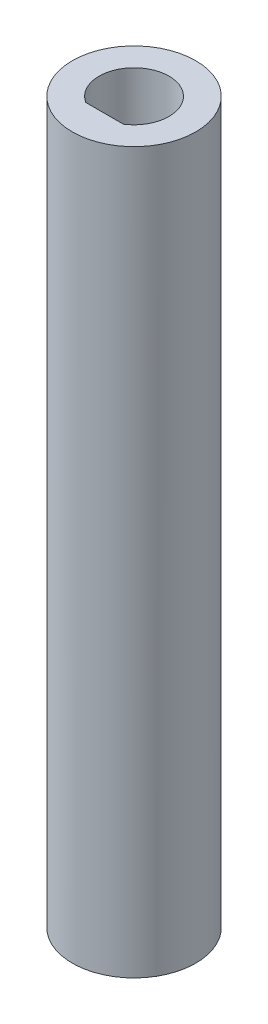
from build123d import *

# Parameters (mm, degrees)
SKETCH1_R           = 5.715
BOSS_EXTRUDE1_DEPTH = 12.7
BOSS_EXTRUDE2_START = 53.975
SKETCH3_R           = 5.715
BOSS_EXTRUDE2_DEPTH = 53.975
CUT_EXTRUDE1_DEPTH  = 53.975


with BuildPart() as part:
    # Sketch1 → Boss-Extrude1 (new body)
    with BuildSketch(Plane(origin=(0, 0, 0), x_dir=(1, 0, 0), z_dir=(0, 1, 0))):
        Circle(SKETCH1_R)
        with BuildLine():
            Line((1.741336269, -2.7305), (-1.741336269, -2.7305))
            ThreePointArc((-1.741336269, -2.7305), (0, 3.2385), (1.741336269, -2.7305))
        make_face(mode=Mode.SUBTRACT)
    extrude(amount=BOSS_EXTRUDE1_DEPTH)

    # Sketch3 → Boss-Extrude2 (add)
    with BuildSketch(Plane(origin=(0, 0, 0), x_dir=(-1, 0, 0), z_dir=(0, -1, 0)).offset(BOSS_EXTRUDE2_START)):
        Circle(SKETCH3_R)
    extrude(amount=-BOSS_EXTRUDE2_DEPTH)

    # Sketch4 → Cut-Extrude1 (cut)
    with BuildSketch(Plane.XZ.offset(53.975)):
        Polygon((0, 2.54), (-1.796051224, 4.336051224), (-4.336051224, 1.796051224), (-2.54, 0), (-4.336051224, -1.796051224), (-1.796051224, -4.336051224), (0, -2.54), (1.796051224, -4.336051224), (4.336051224, -1.796051224), (2.54, 0), (4.336051224, 1.796051224), (1.796051224, 4.336051224), align=None)
    extrude(amount=-CUT_EXTRUDE1_DEPTH, mode=Mode.SUBTRACT)


solid = part.part
